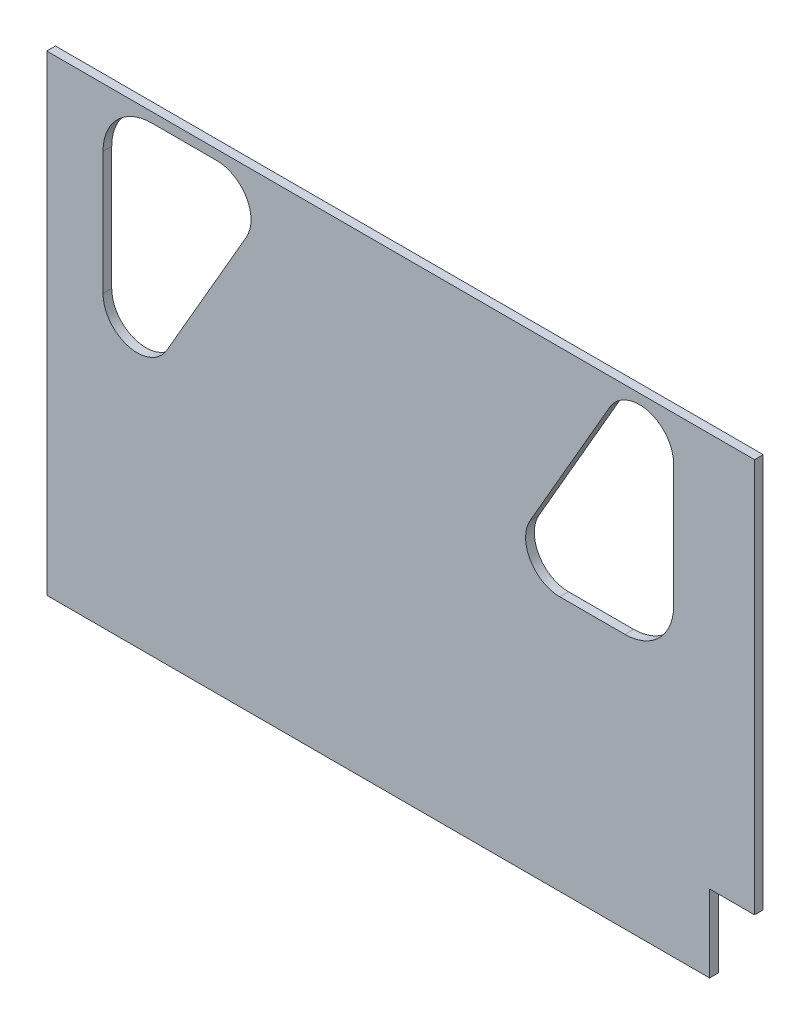
from build123d import *

# Parameters (mm, degrees)
BOSS_EXTRUDE1_DEPTH = 30
CUT_EXTRUDE1_DEPTH  = 2963.161989042


with BuildPart() as part:
    # Sketch1 → Boss-Extrude1 (new body)
    with BuildSketch(Plane.XY):
        Polygon((0, 0), (2285, 0), (2285, 266), (2440, 266), (2440, 1625), (0, 1625), align=None)
    extrude(amount=BOSS_EXTRUDE1_DEPTH)

    # Sketch2 → Cut-Extrude1 (cut, through all)
    with BuildSketch(Plane(origin=(441.963517843, -561.616762327, 31), x_dir=(1, 0, 0), z_dir=(0, 0, 1))):
        with BuildLine():
            Line((1498.845356152, 2093.616540003), (1224.605356152, 1618.616540003))
            ThreePointArc((1224.605356152, 1618.616540003), (1224.605548691, 1500.616651165), (1326.796482157, 1441.616762327))
            Line((1326.796482157, 1441.616762327), (1551.036482157, 1441.616762327))
            ThreePointArc((1551.036482157, 1441.616762327), (1669.830421397, 1490.822823088), (1719.036482157, 1609.616762327))
            Line((1719.036482157, 1609.616762327), (1719.036482157, 2034.616762327))
            ThreePointArc((1719.036482157, 2034.616762327), (1631.577005494, 2148.596043051), (1498.845356152, 2093.616540003))
        make_face()
        with BuildLine():
            Line((-247.963517843, 1984.616762327), (-247.963517843, 1559.616762327))
            ThreePointArc((-247.963517843, 1559.616762327), (-160.504041179, 1445.637481603), (-27.772391837, 1500.616984652))
            Line((-27.772391837, 1500.616984652), (246.467608163, 1975.616984652))
            ThreePointArc((246.467608163, 1975.616984652), (246.467415624, 2093.61687349), (144.276482157, 2152.616762327))
            Line((144.276482157, 2152.616762327), (-79.963517843, 2152.616762327))
            ThreePointArc((-79.963517843, 2152.616762327), (-198.757457082, 2103.410701567), (-247.963517843, 1984.616762327))
        make_face()
    extrude(amount=-CUT_EXTRUDE1_DEPTH, mode=Mode.SUBTRACT)


solid = part.part
